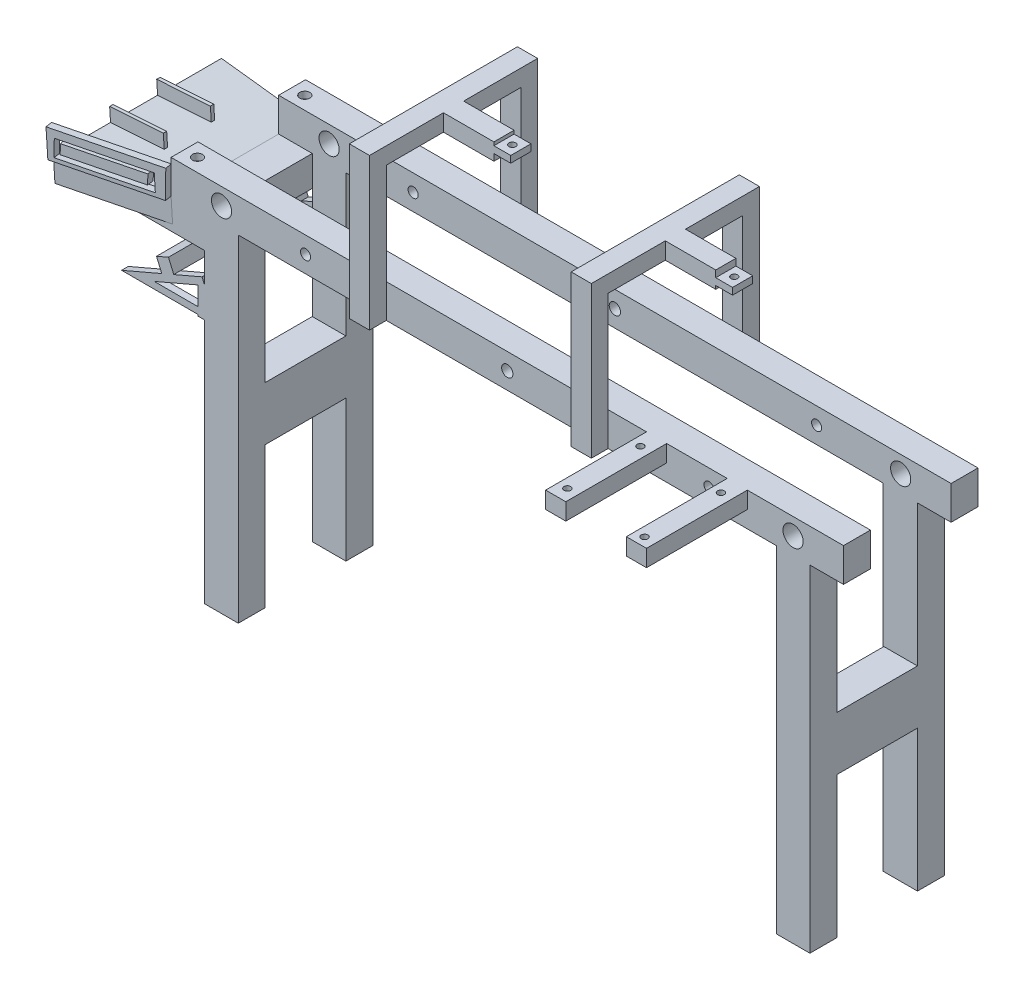
from build123d import *

# Parameters (mm, degrees)
CROQUIS1_W                 = 1000
CROQUIS1_H                 = 50
CROQUIS1_W_2               = 50
CROQUIS1_H_2               = 500
SALIENTE_EXTRUIR1_DEPTH    = 40
CROQUIS3_W                 = 51.55491286
CROQUIS3_H                 = 500
CROQUIS3_W_2               = 1000
CROQUIS3_H_2               = 50
CROQUIS3_W_3               = 50
SALIENTE_EXTRUIR2_DEPTH    = 40
CROQUIS4_W                 = 120
CROQUIS4_H                 = 40
SALIENTE_EXTRUIR3_DEPTH    = 50
SIMETR_A5_START            = 400
SIMETR_A5_OUTLINE_W        = 80
SIMETR_A5_OUTLINE_H        = 120
SIMETR_A5_DEPTH            = 50
SIMETR_A5_START_2          = -450
SIMETR_A5_2_OUTLINE_W      = 40
SIMETR_A5_2_OUTLINE_H      = 120
SIMETR_A5_2_DEPTH          = 50
CROQUIS6_R                 = 15
CORTAR_EXTRUIR2_DEPTH      = 770.740215917
CROQUIS7_W                 = 30
CROQUIS7_H                 = 150
CROQUIS7_R                 = 5
SALIENTE_EXTRUIR7_DEPTH    = 25
CROQUIS8_W                 = 30
CROQUIS8_H                 = 150
CROQUIS8_H_2               = 50
SALIENTE_EXTRUIR8_DEPTH    = 25
SIMETR_A6_START            = -50
SIMETR_A6_OUTLINE_W        = 30
SIMETR_A6_OUTLINE_H        = 25
SIMETR_A6_DEPTH            = 200
CROQUIS9_W                 = 25
CROQUIS9_H                 = 150
CORTAR_EXTRUIR3_DEPTH      = 918.909077881
CROQUIS10_W                = 30
CROQUIS10_H                = 250
SALIENTE_EXTRUIR9_DEPTH    = 25
CROQUIS11_W                = 75
CROQUIS11_H                = 30
SALIENTE_EXTRUIR10_DEPTH   = 25
CROQUIS13_W                = 25
CROQUIS13_H                = 30
SALIENTE_EXTRUIR12_DEPTH   = 20
CROQUIS14_W                = 30
CROQUIS14_H                = 10
CORTAR_EXTRUIR5_DEPTH      = 25
CROQUIS15_R                = 5
CORTAR_EXTRUIR6_DEPTH      = 10
EXTRUIR_L_MINA1_START      = -10
EXTRUIR_L_MINA1_DEPTH      = 10
SALIENTE_EXTRUIR13_DEPTH   = 20
CROQUIS19_W                = 75
CROQUIS19_H                = 30
SALIENTE_EXTRUIR14_DEPTH   = 25
CROQUIS20_W                = 25
CROQUIS20_H                = 30
CROQUIS20_R                = 5
SALIENTE_EXTRUIR15_DEPTH   = 15
CROQUIS21_W                = 30
CROQUIS21_H                = 5
CORTAR_EXTRUIR7_DEPTH      = 25
CROQUIS22_R                = 5
CORTAR_EXTRUIR8_DEPTH      = 25
CROQUIS24_R                = 7.5
CROQUIS24_R_2              = 8.42
CORTAR_EXTRUIR9_DEPTH      = 826.937137629
CROQUIS25_W                = 200
CROQUIS25_H                = 45.025720895
SALIENTE_EXTRUIR16_DEPTH   = 200
CORTAR_EXTRUIR10_DEPTH     = 200
CROQUIS27_R                = 7.5
CORTAR_EXTRUIR11_DEPTH     = 10
SALIENTE_EXTRUIR17_DEPTH   = 34.948144
SALIENTE_EXTRUIR18_DEPTH   = 10
SALIENTE_EXTRUIR18_2_DEPTH = 10
CROQUIS31_W                = 80
CROQUIS31_H                = 5
EXTRUIR_L_MINA3_DEPTH      = 50
CORTAR_EXTRUIR12_DEPTH     = 880.451418574


# Read off the part's stored shape, not the designer's step: Simetría5, Simetría6, Extruir-Lámina1
with BuildPart() as part:
    # Croquis1 → Saliente-Extruir1 (new body)
    with BuildSketch(Plane.XY):
        with Locations((0, -25)):
            Rectangle(CROQUIS1_W, CROQUIS1_H)
        with Locations((-425, -300)):
            Rectangle(CROQUIS1_W_2, CROQUIS1_H_2)
        with Locations((425, -300)):
            Rectangle(CROQUIS1_W_2, CROQUIS1_H_2)
    extrude(amount=SALIENTE_EXTRUIR1_DEPTH)



with BuildPart() as body_2:
    # Croquis3 → Saliente-Extruir2 (new body)
    with BuildSketch(Plane.XY.offset(-160)):
        with Locations((424.22254357, -300)):
            Rectangle(CROQUIS3_W, CROQUIS3_H)
        with Locations((0, -25)):
            Rectangle(CROQUIS3_W_2, CROQUIS3_H_2)
        with Locations((-425, -300)):
            Rectangle(CROQUIS3_W_3, CROQUIS3_H)
    extrude(amount=SALIENTE_EXTRUIR2_DEPTH)


with BuildPart() as part_1:
    add(part.part)

    add(body_2.part)  # Saliente-Extruir3 merges body 2
    # Croquis4 → Saliente-Extruir3 (add)
    with BuildSketch(Plane.ZY.offset(450)):
        with Locations((-60, -320)):
            Rectangle(CROQUIS4_W, CROQUIS4_H)
    extrude(amount=-SALIENTE_EXTRUIR3_DEPTH)

    # Simetría5 outline → Simetría5 (add)
    with BuildSketch(Plane.YZ.offset(SIMETR_A5_START)):
        with Locations((-300, -60)):
            Rectangle(SIMETR_A5_OUTLINE_W, SIMETR_A5_OUTLINE_H)
    extrude(amount=SIMETR_A5_DEPTH)

    # Simetr_a5 2 outline → Simetr_a5 2 (add)
    with BuildSketch(Plane.YZ.offset(SIMETR_A5_START_2)):
        with Locations((-280, -60)):
            Rectangle(SIMETR_A5_2_OUTLINE_W, SIMETR_A5_2_OUTLINE_H)
    extrude(amount=SIMETR_A5_2_DEPTH)

    # Croquis6 → Cortar-Extruir2 (cut, through all)
    with BuildSketch(Plane.XY.offset(40)):
        with Locations((425, -25)):
            Circle(CROQUIS6_R)
        with Locations((-425, -25)):
            Circle(CROQUIS6_R)
    extrude(amount=-CORTAR_EXTRUIR2_DEPTH, mode=Mode.SUBTRACT)

    # Croquis7 → Saliente-Extruir7 (add)
    # profile 1 of 2: a face of its own
    with BuildSketch(Plane(origin=(0, 0, 0), x_dir=(1, 0, 0), z_dir=(0, 1, 0))):
        with Locations((222.02534833, -115)):
            Rectangle(CROQUIS7_W, CROQUIS7_H)
        with Locations(Location((221.051734852, -171.73047465, 0), (0, 0, 180))):
            Circle(CROQUIS7_R, mode=Mode.SUBTRACT)
        with Locations(Location((221.051734852, -63.031460394, 0), (0, 0, 180))):
            Circle(CROQUIS7_R, mode=Mode.SUBTRACT)
    # profile 2 of 2: a face of its own
    with BuildSketch(Plane(origin=(0, 0, 0), x_dir=(1, 0, 0), z_dir=(0, 1, 0))):
        with Locations((342.02534833, -115)):
            Rectangle(CROQUIS7_W, CROQUIS7_H)
        with Locations(Location((340.842485257, -176.73047465, 0), (0, 0, 180))):
            Circle(CROQUIS7_R, mode=Mode.SUBTRACT)
        with Locations(Location((340.842485257, -63.031460394, 0), (0, 0, 180))):
            Circle(CROQUIS7_R, mode=Mode.SUBTRACT)
    extrude(amount=-SALIENTE_EXTRUIR7_DEPTH)

    # Croquis8 → Saliente-Extruir8 (add)
    with BuildSketch(Plane.XY.offset(40)):
        with Locations((-194.899341637, 75)):
            Rectangle(CROQUIS8_W, CROQUIS8_H)
        with Locations((135, 75)):
            Rectangle(CROQUIS8_W, CROQUIS8_H)
        Polygon((120, -50), (120.100658363, -50), (150, -50), (150, 0), (120, 0), align=None)
        with Locations((-194.899341637, -25)):
            Rectangle(CROQUIS8_W, CROQUIS8_H_2)
    extrude(amount=SALIENTE_EXTRUIR8_DEPTH)

    # Simetría6 outline → Simetría6 (add)
    with BuildSketch(Plane(origin=(0, 0, 0), x_dir=(1, 0, 0), z_dir=(0, 1, 0)).offset(SIMETR_A6_START)):
        with Locations((-194.899341637, -27.5)):
            Rectangle(SIMETR_A6_OUTLINE_W, SIMETR_A6_OUTLINE_H)
        with Locations((-194.899341637, 172.5)):
            Rectangle(SIMETR_A6_OUTLINE_W, SIMETR_A6_OUTLINE_H)
        with Locations((135, -27.5)):
            Rectangle(SIMETR_A6_OUTLINE_W, SIMETR_A6_OUTLINE_H)
        with Locations((135, 172.5)):
            Rectangle(SIMETR_A6_OUTLINE_W, SIMETR_A6_OUTLINE_H)
    extrude(amount=SIMETR_A6_DEPTH)

    # Croquis9 → Cortar-Extruir3 (cut, through all)
    with BuildSketch(Plane.ZY.offset(209.899341637)):
        with Locations((27.5, 75)):
            Rectangle(CROQUIS9_W, CROQUIS9_H)
    extrude(amount=-CORTAR_EXTRUIR3_DEPTH, mode=Mode.SUBTRACT)

    # Croquis10 → Saliente-Extruir9 (add)
    with BuildSketch(Plane(origin=(0, 150, 0), x_dir=(1, 0, 0), z_dir=(0, 1, 0))):
        with Locations((-194.899341637, 60)):
            Rectangle(CROQUIS10_W, CROQUIS10_H)
        with Locations((135, 60)):
            Rectangle(CROQUIS10_W, CROQUIS10_H)
    extrude(amount=SALIENTE_EXTRUIR9_DEPTH)

    # Croquis11 → Saliente-Extruir10 (add)
    with BuildSketch(Plane(origin=(0, 175, 0), x_dir=(1, 0, 0), z_dir=(0, 1, 0))):
        with Locations((187.5, 60)):
            Rectangle(CROQUIS11_W, CROQUIS11_H)
    extrude(amount=-SALIENTE_EXTRUIR10_DEPTH)

    # Croquis13 → Saliente-Extruir12 (add)
    with BuildSketch(Plane(origin=(0, 175, 0), x_dir=(1, 0, 0), z_dir=(0, 1, 0))):
        with Locations((237.5, 60)):
            Rectangle(CROQUIS13_W, CROQUIS13_H)
    extrude(amount=-SALIENTE_EXTRUIR12_DEPTH)

    # Croquis14 → Cortar-Extruir5 (cut)
    with BuildSketch(Plane(origin=(250, 0, 0), x_dir=(0, 0, -1), z_dir=(1, 0, 0))):
        with Locations((60, 170)):
            Rectangle(CROQUIS14_W, CROQUIS14_H)
    extrude(amount=-CORTAR_EXTRUIR5_DEPTH, mode=Mode.SUBTRACT)

    # Croquis15 → Cortar-Extruir6 (cut)
    with BuildSketch(Plane(origin=(0, 165, 0), x_dir=(1, 0, 0), z_dir=(0, 1, 0))):
        with Locations(Location((237.5, 60, 0), (0, 0, 180))):
            Circle(CROQUIS15_R)
    extrude(amount=-CORTAR_EXTRUIR6_DEPTH, mode=Mode.SUBTRACT)

    # Extruir-Lámina1 outline → Extruir-Lámina1 (add)
    with BuildSketch(Plane(origin=(0, 0, -160), x_dir=(-1, 0, 0), z_dir=(0, 0, -1)).offset(EXTRUIR_L_MINA1_START)):
        Polygon((450, -184.470843572), (460, -184.470843572), (460, -182.261142681), (573.626320277, -182.261142681), (453.946110361, -130.862959161), (450, -140.05144179), align=None)
        Polygon((525, -172.261142681), (460, -172.261142681), (460, -144.346068575), align=None, mode=Mode.SUBTRACT)
    extruir_l_mina1 = extrude(amount=EXTRUIR_L_MINA1_DEPTH)

    # Simetría7: Extruir-Lámina1 across plane
    add(extruir_l_mina1.mirror(Plane.XY.offset(-60)))

    # Croquis18 → Saliente-Extruir13 (add)
    with BuildSketch(Plane(origin=(-23.238226525, 54.110002303, 0), x_dir=(0.9188482628553936, 0.39461103614524734, 0), z_dir=(-0.3946110361452473, 0.9188482628553934, 0))):
        Polygon((-533.87268456, 150), (-533.87268456, -30), (-533.87268456, -40), (-514.481606186, -40), (-514.481606186, -30), (-514.481606186, 150), (-514.481606186, 160), (-533.87268456, 160), align=None)
    extrude(amount=SALIENTE_EXTRUIR13_DEPTH)

    # Croquis19 → Saliente-Extruir14 (add)
    with BuildSketch(Plane(origin=(0, 175, 0), x_dir=(1, 0, 0), z_dir=(0, 1, 0))):
        with Locations((-142.399341637, 60)):
            Rectangle(CROQUIS19_W, CROQUIS19_H)
    extrude(amount=-SALIENTE_EXTRUIR14_DEPTH)

    # Croquis20 → Saliente-Extruir15 (add)
    with BuildSketch(Plane(origin=(0, 175, 0), x_dir=(1, 0, 0), z_dir=(0, 1, 0))):
        with Locations((-92.399341637, 60)):
            Rectangle(CROQUIS20_W, CROQUIS20_H)
        with Locations(Location((-92.399341637, 60, 0), (0, 0, 180))):
            Circle(CROQUIS20_R, mode=Mode.SUBTRACT)
    extrude(amount=-SALIENTE_EXTRUIR15_DEPTH)

    # Croquis21 → Cortar-Extruir7 (cut)
    with BuildSketch(Plane(origin=(-79.899341637, 0, 0), x_dir=(0, 0, -1), z_dir=(1, 0, 0))):
        with Locations((60, 172.5)):
            Rectangle(CROQUIS21_W, CROQUIS21_H)
    extrude(amount=-CORTAR_EXTRUIR7_DEPTH, mode=Mode.SUBTRACT)

    # Croquis22 → Cortar-Extruir8 (cut)
    with BuildSketch(Plane(origin=(-31.130447248, 72.48696756, 0), x_dir=(0.9188482628553936, 0.39461103614524734, 0), z_dir=(-0.3946110361452473, 0.9188482628553934, 0))):
        with Locations(Location((-524.177145373, 60, 0), (0, 0, 180))):
            Circle(CROQUIS22_R)
    extrude(amount=-CORTAR_EXTRUIR8_DEPTH, mode=Mode.SUBTRACT)

    # Croquis24 → Cortar-Extruir9 (cut, through all)
    with BuildSketch(Plane.XY.offset(40)):
        with Locations((-300, -25)):
            Circle(CROQUIS24_R)
        with Locations((0, -25)):
            Circle(CROQUIS24_R_2)
        with Locations((300, -25)):
            Circle(CROQUIS24_R)
    extrude(amount=-CORTAR_EXTRUIR9_DEPTH, mode=Mode.SUBTRACT)

    # Croquis25 → Saliente-Extruir16 (add)
    with BuildSketch(Plane.ZY.offset(450)):
        with Locations((-60, -72.512860448)):
            Rectangle(CROQUIS25_W, CROQUIS25_H)
    extrude(amount=SALIENTE_EXTRUIR16_DEPTH)

    # Croquis26 → Cortar-Extruir10 (cut)
    with BuildSketch(Plane.XY.offset(40)):
        Polygon((-650, -50), (-650, -60), (-500, -50), align=None)
    extrude(amount=-CORTAR_EXTRUIR10_DEPTH, mode=Mode.SUBTRACT)

    # Croquis27 → Cortar-Extruir11 (cut)
    with BuildSketch(Plane(origin=(0, 0, 0), x_dir=(1, 0, 0), z_dir=(0, 1, 0))):
        with Locations(Location((-480.485143318, 139.403864671, 0), (0, 0, 180))):
            Circle(CROQUIS27_R)
        with Locations(Location((-480.485143318, -20.213903124, 0), (0, 0, 180))):
            Circle(CROQUIS27_R)
    extrude(amount=-CORTAR_EXTRUIR11_DEPTH, mode=Mode.SUBTRACT)

    # Croquis28 → Saliente-Extruir17 (add)
    with BuildSketch(Plane(origin=(1.10619469, -16.592920354, 0), x_dir=(0.997785157856609, 0.06651901052377408, 0), z_dir=(-0.06651901052377408, 0.997785157856609, 0))):
        Polygon((-652.551493238, 160), (-652.551493238, 185), (-502.218529454, 160), align=None)
        Polygon((-652.551493238, -40), (-652.551493238, -65), (-502.218529454, -40), align=None)
    extrude(amount=-SALIENTE_EXTRUIR17_DEPTH)

    # Croquis31 → Extruir-Lámina3 (add)
    with BuildSketch(Plane(origin=(1.10619469, -16.592920354, 0), x_dir=(0.997785157856609, 0.06651901052377408, 0), z_dir=(-0.06651901052377408, 0.997785157856609, 0))):
        with Locations((-612.551493238, 22.5)):
            Rectangle(CROQUIS31_W, CROQUIS31_H)
        with Locations((-612.551493238, 92.5)):
            Rectangle(CROQUIS31_W, CROQUIS31_H)
    extrude(amount=EXTRUIR_L_MINA3_DEPTH)

    # Croquis33 → Cortar-Extruir12 (cut, through all)
    with BuildSketch(Plane.XY.offset(-20)):
        Polygon((-653.325950526, -10.110742107), (-573.503137898, -4.789221265), (-571.507567582, -34.722776001), (-651.33038021, -40.044296843), align=None)
    extrude(amount=-CORTAR_EXTRUIR12_DEPTH, mode=Mode.SUBTRACT)


with BuildPart() as body_2_2:
    # Croquis29 → Saliente-Extruir18 (new body)
    with BuildSketch(Plane(origin=(-7.026539147, -0.468435943, -42.346609257), x_dir=(0.9865132624966768, -0.0018105235842012348, -0.1636713320117914), z_dir=(0.1636813456633437, 0.010912089710889604, 0.9864529098644185))):
        Polygon((-651.763625789, -60.715311897), (-499.71295835, -50.43939192), (-499.787786937, -9.112114788), (-654.54425611, -19.570898823), align=None)
        Polygon((-643.749703116, -29.775753354), (-514.586177994, -21.046597012), (-512.908383516, -45.872575681), (-643.749703116, -54.715121081), align=None, mode=Mode.SUBTRACT)
    extrude(amount=SALIENTE_EXTRUIR18_DEPTH)


with BuildPart() as body_3:
    # Croquis29 → Saliente-Extruir18 2 (new body)
    with BuildSketch(Plane(origin=(-7.026539147, -0.468435943, -42.346609257), x_dir=(0.9865132624966768, -0.0018105235842012348, -0.1636713320117914), z_dir=(0.1636813456633437, 0.010912089710889604, 0.9864529098644185))):
        Polygon((-635.890490528, -33.459586346), (-522.87630528, -25.821838065), (-522.87630528, -40.14310536), (-635.890490528, -47.780853641), align=None)
    extrude(amount=SALIENTE_EXTRUIR18_2_DEPTH)


solid = Compound([part_1.part, body_2_2.part, body_3.part])
